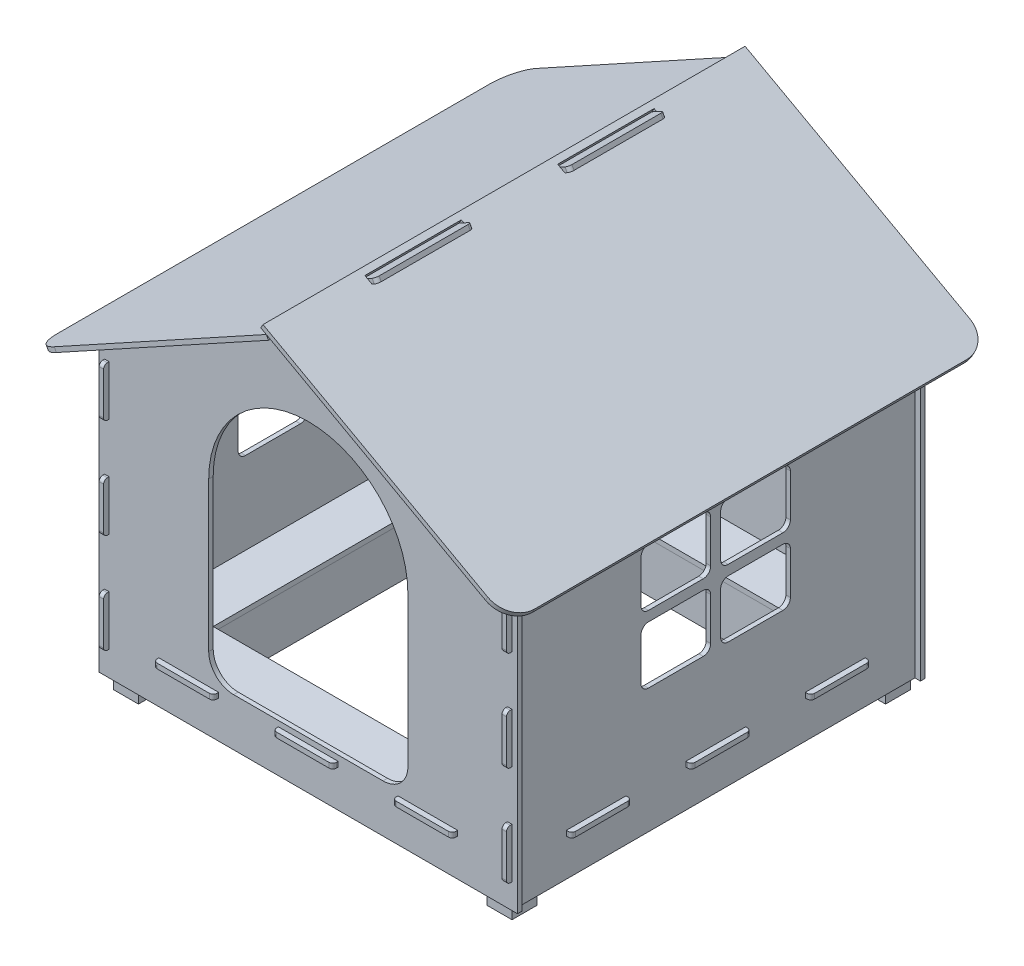
from build123d import *

# Parameters (mm, degrees)
STRUCTURAL_START               = -800
STRUCTURAL_MEMBER2_OUTLINE_W   = 1250
STRUCTURAL_MEMBER2_OUTLINE_H   = 100
STRUCTURAL_MEMBER2_DEPTH       = 100
STRUCTURAL_START_2             = 700
STRUCTURAL_MEMBER2_2_OUTLINE_W = 1250
STRUCTURAL_MEMBER2_2_OUTLINE_H = 100
STRUCTURAL_MEMBER2_2_DEPTH     = 100
STRUCTURAL_MEMBER4_DEPTH       = 2001.997512422
STRUCTURAL_MEMBER4_DEPTH_BACK  = 401.997512422
SKETCH18_W                     = 200
SKETCH18_H                     = 20
SKETCH18_ON_SEGMENT_2_W        = 200
SKETCH18_ON_SEGMENT_2_H        = 20
STRUCTURAL_MEMBER4_2_DEPTH     = 2403.995024845
SKETCH18_ON_SEGMENT_3_W        = 200
SKETCH18_ON_SEGMENT_3_H        = 20
STRUCTURAL_MEMBER4_3_DEPTH     = 2403.995024845
SKETCH18_ON_SEGMENT_4_W        = 200
SKETCH18_ON_SEGMENT_4_H        = 20
STRUCTURAL_MEMBER4_4_DEPTH     = 2403.995024845
STRUCTURAL_START_3             = -600
STRUCTURAL_MEMBER5_OUTLINE_W   = 20
STRUCTURAL_MEMBER5_OUTLINE_H   = 200
STRUCTURAL_MEMBER5_DEPTH       = 1200
STRUCTURAL_START_4             = -200
STRUCTURAL_MEMBER5_2_OUTLINE_W = 1240
STRUCTURAL_MEMBER5_2_OUTLINE_H = 20
STRUCTURAL_MEMBER5_2_DEPTH     = 200
STRUCTURAL_MEMBER5_3_OUTLINE_W = 1240
STRUCTURAL_MEMBER5_3_OUTLINE_H = 20
STRUCTURAL_MEMBER5_3_DEPTH     = 200
STRUCTURAL_MEMBER5_4_OUTLINE_W = 20
STRUCTURAL_MEMBER5_4_OUTLINE_H = 200
STRUCTURAL_MEMBER5_4_DEPTH     = 1200
MOVE_FACE2_BY                  = 40
MOVE_FACE2_2_BY                = 40
MOVE_FACE2_3_BY                = 40
MOVE_FACE2_4_BY                = 40
SKETCH110_W                    = 200
SKETCH110_H                    = 18
STRUCTURAL_MEMBER6_DEPTH       = 1936
MOVE_START                     = -1332.256013198
MOVE_FACE3_OUTLINE_W           = 930
MOVE_FACE3_OUTLINE_H           = 1936
MOVE_FACE3_DEPTH               = 18
FILLET5_R                      = 100
STRUCTURAL_START_5             = -150
STRUCTURAL_MEMBER7_OUTLINE_W   = 1600
STRUCTURAL_MEMBER7_OUTLINE_H   = 18
STRUCTURAL_MEMBER7_DEPTH       = 200
STRUCTURAL_MEMBER7_2_OUTLINE_W = 1600
STRUCTURAL_MEMBER7_2_OUTLINE_H = 18
STRUCTURAL_MEMBER7_2_DEPTH     = 200
STRUCTURAL_MEMBER7_3_OUTLINE_W = 18
STRUCTURAL_MEMBER7_3_OUTLINE_H = 1636
STRUCTURAL_MEMBER7_3_DEPTH     = 200
STRUCTURAL_MEMBER7_4_OUTLINE_W = 18
STRUCTURAL_MEMBER7_4_OUTLINE_H = 1636
STRUCTURAL_MEMBER7_4_DEPTH     = 200
MOVE_START_2                   = -818
MOVE_FACE4_OUTLINE_W           = 1000
MOVE_FACE4_OUTLINE_H           = 1636
MOVE_FACE4_DEPTH               = 18
MOVE_START_3                   = 800
MOVE_FACE4_2_OUTLINE_W         = 1000
MOVE_FACE4_2_OUTLINE_H         = 1636
MOVE_FACE4_2_DEPTH             = 18
MOVE_START_4                   = -800
MOVE_FACE5_OUTLINE_W           = 1450
MOVE_FACE5_OUTLINE_H           = 18
MOVE_FACE5_DEPTH               = 1600
MOVE_START_5                   = -840
MOVE_FACE6_OUTLINE_W           = 1650
MOVE_FACE6_OUTLINE_H           = 18
MOVE_FACE6_DEPTH               = 1680
MOVE_FACE7_BY                  = 22
MOVE_FACE7_2_BY                = 22
MOVE_FACE7_3_BY                = 22
MOVE_FACE7_4_BY                = 22
TRIM_EXTEND3_START             = -818
TRIM_EXTEND3_DEPTH             = 18
TRIM_EXTEND3_START_2           = 800
TRIM_EXTEND3_2_DEPTH           = 18
SKETCH113_W                    = 32.72
SKETCH113_H                    = 387.2
CUT_EXTRUDE2_DEPTH             = 18
SKETCH115_W                    = 32.72
SKETCH115_H                    = 387.2
SKETCH115_W_2                  = 25.080844949
CUT_EXTRUDE3_DEPTH             = 18
SKETCH117_W                    = 280
SKETCH117_H                    = 230
CUT_EXTRUDE4_DEPTH             = 2542.143663625
FILLET1_R                      = 30
FILLET2_R                      = 30
SKETCH119_W                    = 280
SKETCH119_H                    = 230
CUT_EXTRUDE7_DEPTH             = 18
FILLET4_R                      = 30
CUT_EXTRUDE8_DEPTH             = 18
SKETCH121_W                    = 40
SKETCH121_H                    = 200
SKETCH121_H_2                  = 100
CUT_EXTRUDE9_DEPTH             = 2542.143663625
SKETCH122_W                    = 18
SKETCH122_H                    = 200
CUT_EXTRUDE10_DEPTH            = 2545.327980132
SKETCH123_W                    = 100
SKETCH123_H                    = 20
SKETCH123_W_2                  = 240
CUT_EXTRUDE12_DEPTH            = 40
SKETCH124_W                    = 240
SKETCH124_H                    = 20
CUT_EXTRUDE13_DEPTH            = 1636
SKETCH125_W                    = 100
SKETCH125_H                    = 20
SKETCH125_W_2                  = 240
CUT_EXTRUDE14_DEPTH            = 40
SKETCH126_W                    = 240
SKETCH126_H                    = 20
CUT_EXTRUDE15_DEPTH            = 2545.327980132
FILLET6_R                      = 100
FILLET7_R                      = 15
FILLET8_R                      = 15
FILLET9_R                      = 15
CIRPATTERN5_COUNT              = 4


# Read off the part's stored shape, not the designer's step: Structural Member2, Structural Member5, Move Face3, Structural Member7, Move Face4, Move Face5, Move Face6, Trim/Extend3
with BuildPart() as part:
    # Structural Member2 outline → Structural Member2 (new body)
    with BuildSketch(Plane.YZ.offset(STRUCTURAL_START)):
        with Locations((425, -750)):
            Rectangle(STRUCTURAL_MEMBER2_OUTLINE_W, STRUCTURAL_MEMBER2_OUTLINE_H)
        with Locations((425, 750)):
            Rectangle(STRUCTURAL_MEMBER2_OUTLINE_W, STRUCTURAL_MEMBER2_OUTLINE_H)
    extrude(amount=STRUCTURAL_MEMBER2_DEPTH)


with BuildPart() as body_2:
    # Structural Member2 2 outline → Structural Member2 2 (new body)
    with BuildSketch(Plane.YZ.offset(STRUCTURAL_START_2)):
        with Locations((425, -750)):
            Rectangle(STRUCTURAL_MEMBER2_2_OUTLINE_W, STRUCTURAL_MEMBER2_2_OUTLINE_H)
        with Locations((425, 750)):
            Rectangle(STRUCTURAL_MEMBER2_2_OUTLINE_W, STRUCTURAL_MEMBER2_2_OUTLINE_H)
    extrude(amount=STRUCTURAL_MEMBER2_2_DEPTH)


with BuildPart() as body_3:
    # Sketch18 → Structural Member4 (new, two sides: drawn at the far end of the back side and taken through both)
    with BuildSketch(Plane(origin=(-600, 0, 800), x_dir=(-1, 0, 0), z_dir=(0, 0, -1)).offset(-STRUCTURAL_MEMBER4_DEPTH_BACK)):
        with Locations((100, 10)):
            Rectangle(SKETCH18_W, SKETCH18_H)
    extrude(amount=STRUCTURAL_MEMBER4_DEPTH + STRUCTURAL_MEMBER4_DEPTH_BACK)

    # Structural Member4 mitre 1
    split(bisect_by=Plane(origin=(-800, 0, 800), x_dir=(0, -1, 0), z_dir=(-0.707106781, 0, -0.707106781)), keep=Keep.TOP)

    # Structural Member4 mitre 2
    split(bisect_by=Plane(origin=(-800, 0, -800), x_dir=(0, -1, 0), z_dir=(-0.707106781, 0, 0.707106781)), keep=Keep.TOP)

    # Trim/Extend2
    split(bisect_by=Plane(origin=(750, 425, -700), x_dir=(0, -1, 0), z_dir=(0, 0, 1)), keep=Keep.TOP)

    # Trim_Extend2 40
    split(bisect_by=Plane(origin=(-750, 425, 700), x_dir=(0, 1, 0), z_dir=(0, 0, -1)), keep=Keep.TOP)

    # Move Face2: a face moved outward by 40.0
    extrude(body_3.faces().sort_by_distance((-800, 10, 0))[0], amount=MOVE_FACE2_BY, dir=(-1, 0, 0))


with BuildPart() as body_4:
    # Sketch18 on segment 2 (carried to segment 2) → Structural Member4 2 (new body)
    with BuildSketch(Plane(origin=(-1201.997512422, 0, -600), x_dir=(0, 0, -1), z_dir=(1, 0, 0))):
        with Locations((100, 10)):
            Rectangle(SKETCH18_ON_SEGMENT_2_W, SKETCH18_ON_SEGMENT_2_H)
    extrude(amount=STRUCTURAL_MEMBER4_2_DEPTH)

    # Structural Member4 2 mitre 1
    split(bisect_by=Plane(origin=(-800, 0, -800), x_dir=(0, 1, 0), z_dir=(0.707106781, 0, -0.707106781)), keep=Keep.TOP)

    # Structural Member4 2 mitre 2
    split(bisect_by=Plane(origin=(800, 0, -800), x_dir=(0, -1, 0), z_dir=(-0.707106781, 0, -0.707106781)), keep=Keep.TOP)

    # Trim_Extend2 13
    split(bisect_by=Plane(origin=(700, 425, 750), x_dir=(0, -1, 0), z_dir=(-1, 0, 0)), keep=Keep.TOP)

    # Trim_Extend2 44
    split(bisect_by=Plane(origin=(-700, 425, 750), x_dir=(0, 1, 0), z_dir=(1, 0, 0)), keep=Keep.TOP)

    # Move Face2 2: a face moved outward by 40.0
    extrude(body_4.faces().sort_by_distance((0, 10, -800))[0], amount=MOVE_FACE2_2_BY, dir=(0, 0, -1))

    # Sketch125 → Cut-Extrude14 (cut)
    with BuildSketch(Plane.XY.offset(-840)):
        with Locations((650, 10)):
            Rectangle(SKETCH125_W, SKETCH125_H)
        with Locations((240, 10)):
            Rectangle(SKETCH125_W_2, SKETCH125_H)
        with Locations((-240, 10)):
            Rectangle(SKETCH125_W_2, SKETCH125_H)
        with Locations((-650, 10)):
            Rectangle(SKETCH125_W, SKETCH125_H)
    cut_extrude14 = extrude(amount=CUT_EXTRUDE14_DEPTH, mode=Mode.SUBTRACT)


with BuildPart() as body_5:
    # Sketch18 on segment 3 (carried to segment 3) → Structural Member4 3 (new body)
    with BuildSketch(Plane(origin=(600, 0, -1201.997512422), x_dir=(1, 0, 0), z_dir=(0, 0, 1))):
        with Locations((100, 10)):
            Rectangle(SKETCH18_ON_SEGMENT_3_W, SKETCH18_ON_SEGMENT_3_H)
    extrude(amount=STRUCTURAL_MEMBER4_3_DEPTH)

    # Structural Member4 3 mitre 1
    split(bisect_by=Plane(origin=(800, 0, 800), x_dir=(0, 1, 0), z_dir=(0.707106781, 0, -0.707106781)), keep=Keep.TOP)

    # Structural Member4 3 mitre 2
    split(bisect_by=Plane(origin=(800, 0, -800), x_dir=(0, 1, 0), z_dir=(0.707106781, 0, 0.707106781)), keep=Keep.TOP)

    # Trim_Extend2 29: cut body 2
    add(body_2.part, mode=Mode.SUBTRACT)

    # Move Face2 3: a face moved outward by 40.0
    extrude(body_5.faces().sort_by_distance((800, 10, 0))[0], amount=MOVE_FACE2_3_BY, dir=(1, 0, 0))

    # Sketch123 → Cut-Extrude12 (cut)
    with BuildSketch(Plane(origin=(840, 0, 0), x_dir=(0, 0, -1), z_dir=(1, 0, 0))):
        with Locations((-650, 10)):
            Rectangle(SKETCH123_W, SKETCH123_H)
        with Locations((-240, 10)):
            Rectangle(SKETCH123_W_2, SKETCH123_H)
        with Locations((240, 10)):
            Rectangle(SKETCH123_W_2, SKETCH123_H)
        with Locations((650, 10)):
            Rectangle(SKETCH123_W, SKETCH123_H)
    cut_extrude12 = extrude(amount=-CUT_EXTRUDE12_DEPTH, mode=Mode.SUBTRACT)


with BuildPart() as body_6:
    # Sketch18 on segment 4 (carried to segment 4) → Structural Member4 4 (new body)
    with BuildSketch(Plane(origin=(1201.997512422, 0, 600), x_dir=(0, 0, 1), z_dir=(-1, 0, 0))):
        with Locations((100, 10)):
            Rectangle(SKETCH18_ON_SEGMENT_4_W, SKETCH18_ON_SEGMENT_4_H)
    extrude(amount=STRUCTURAL_MEMBER4_4_DEPTH)

    # Structural Member4 4 mitre 1
    split(bisect_by=Plane(origin=(-800, 0, 800), x_dir=(0, 1, 0), z_dir=(0.707106781, 0, 0.707106781)), keep=Keep.TOP)

    # Structural Member4 4 mitre 2
    split(bisect_by=Plane(origin=(800, 0, 800), x_dir=(0, -1, 0), z_dir=(-0.707106781, 0, 0.707106781)), keep=Keep.TOP)

    # Trim_Extend2 5
    split(bisect_by=Plane(origin=(700, 425, -750), x_dir=(0, -1, 0), z_dir=(-1, 0, 0)), keep=Keep.TOP)

    # Trim_Extend2 36
    split(bisect_by=Plane(origin=(-700, 425, -750), x_dir=(0, 1, 0), z_dir=(1, 0, 0)), keep=Keep.TOP)

    # Move Face2 4: a face moved outward by 40.0
    extrude(body_6.faces().sort_by_distance((0, 10, 800))[0], amount=MOVE_FACE2_4_BY, dir=(0, 0, 1))

    # Mirror4: Cut-Extrude14 across plane
    add(cut_extrude14.mirror(Plane.XY), mode=Mode.SUBTRACT)


with BuildPart() as body_7:
    # Structural Member5 outline → Structural Member5 (new body)
    with BuildSketch(Plane.XY.offset(STRUCTURAL_START_3)):
        with Locations((-610, -100)):
            Rectangle(STRUCTURAL_MEMBER5_OUTLINE_W, STRUCTURAL_MEMBER5_OUTLINE_H)
    extrude(amount=STRUCTURAL_MEMBER5_DEPTH)


with BuildPart() as body_8:
    # Structural Member5 2 outline → Structural Member5 2 (new body)
    with BuildSketch(Plane(origin=(0, 0, 0), x_dir=(1, 0, 0), z_dir=(0, 1, 0)).offset(STRUCTURAL_START_4)):
        with Locations((0, -610)):
            Rectangle(STRUCTURAL_MEMBER5_2_OUTLINE_W, STRUCTURAL_MEMBER5_2_OUTLINE_H)
    extrude(amount=STRUCTURAL_MEMBER5_2_DEPTH)


with BuildPart() as body_9:
    # Structural Member5 3 outline → Structural Member5 3 (new body)
    with BuildSketch(Plane(origin=(0, 0, 0), x_dir=(1, 0, 0), z_dir=(0, 1, 0)).offset(STRUCTURAL_START_4)):
        with Locations((0, 610)):
            Rectangle(STRUCTURAL_MEMBER5_3_OUTLINE_W, STRUCTURAL_MEMBER5_3_OUTLINE_H)
    extrude(amount=STRUCTURAL_MEMBER5_3_DEPTH)


with BuildPart() as body_10:
    # Structural Member5 4 outline → Structural Member5 4 (new body)
    with BuildSketch(Plane.XY.offset(STRUCTURAL_START_3)):
        with Locations((610, -100)):
            Rectangle(STRUCTURAL_MEMBER5_4_OUTLINE_W, STRUCTURAL_MEMBER5_4_OUTLINE_H)
    extrude(amount=STRUCTURAL_MEMBER5_4_DEPTH)


with BuildPart() as body_11:
    # Sketch110 → Structural Member6 (new body)
    with BuildSketch(Plane(origin=(-949.42560132, 977.699852575, -968), x_dir=(0.876170675465456, 0.4820009828355196, 0), z_dir=(0, 0, 1))):
        with Locations((100, 9)):
            Rectangle(SKETCH110_W, SKETCH110_H)
    extrude(amount=STRUCTURAL_MEMBER6_DEPTH)

    # Move Face3 outline → Move Face3 (add)
    with BuildSketch(Plane(origin=(0, 0, 0), x_dir=(0.8761706754654556, 0.4820009828355199, 0), z_dir=(0.4820009828355199, -0.8761706754654558, 0)).offset(MOVE_START)):
        with Locations((304.393419447, 0)):
            Rectangle(MOVE_FACE3_OUTLINE_W, MOVE_FACE3_OUTLINE_H)
    extrude(amount=MOVE_FACE3_DEPTH)

    # Fillet5
    fillet5_edges = [body_11.edges().sort_by_distance(p)[0] for p in [
        (-953.763610165, 985.585388654, 968),
        (-953.763610165, 985.585388654, -968),
    ]]
    fillet(fillet5_edges, radius=FILLET5_R)


with BuildPart() as body_12:
    # Mirror1: mirrored copy
    add(body_11.part.mirror(Plane(origin=(0, 0, 0), x_dir=(0, 0, 1), z_dir=(1, 0, 0))))

    # Sketch113 → Cut-Extrude2 (cut)
    with BuildSketch(Plane(origin=(642.14870775, 1167.283650977, 0), x_dir=(0.876170675465456, -0.4820009828355195, 0), z_dir=(0.48200098283551945, 0.8761706754654559, 0))):
        with Locations((-727.952574498, -387.2)):
            Rectangle(SKETCH113_W, SKETCH113_H)
        with Locations((-727.952574498, 387.2)):
            Rectangle(SKETCH113_W, SKETCH113_H)
    extrude(amount=-CUT_EXTRUDE2_DEPTH, mode=Mode.SUBTRACT)


with BuildPart() as body_13:
    # Structural Member7 outline → Structural Member7 (new body)
    with BuildSketch(Plane(origin=(0, 0, 0), x_dir=(1, 0, 0), z_dir=(0, 1, 0)).offset(STRUCTURAL_START_5)):
        with Locations((0, -809)):
            Rectangle(STRUCTURAL_MEMBER7_OUTLINE_W, STRUCTURAL_MEMBER7_OUTLINE_H)
    extrude(amount=STRUCTURAL_MEMBER7_DEPTH)



with BuildPart() as body_14:
    # Structural Member7 2 outline → Structural Member7 2 (new body)
    with BuildSketch(Plane(origin=(0, 0, 0), x_dir=(1, 0, 0), z_dir=(0, 1, 0)).offset(STRUCTURAL_START_5)):
        with Locations((0, 809)):
            Rectangle(STRUCTURAL_MEMBER7_2_OUTLINE_W, STRUCTURAL_MEMBER7_2_OUTLINE_H)
    extrude(amount=STRUCTURAL_MEMBER7_2_DEPTH)


with BuildPart() as body_15:
    # Structural Member7 3 outline → Structural Member7 3 (new body)
    with BuildSketch(Plane(origin=(0, 0, 0), x_dir=(1, 0, 0), z_dir=(0, 1, 0)).offset(STRUCTURAL_START_5)):
        with Locations((-809, 0)):
            Rectangle(STRUCTURAL_MEMBER7_3_OUTLINE_W, STRUCTURAL_MEMBER7_3_OUTLINE_H)
    extrude(amount=STRUCTURAL_MEMBER7_3_DEPTH)

    # Move Face4 outline → Move Face4 (add)
    with BuildSketch(Plane.YZ.offset(MOVE_START_2)):
        with Locations((550, 0)):
            Rectangle(MOVE_FACE4_OUTLINE_W, MOVE_FACE4_OUTLINE_H)
    extrude(amount=MOVE_FACE4_DEPTH)

    # Move Face7: a face moved outward by 22.0
    extrude(body_15.faces().sort_by_distance((-809, 450, 818))[0], amount=MOVE_FACE7_BY, dir=(0, 0, 1))

    # Move Face7 2: a face moved outward by 22.0
    extrude(body_15.faces().sort_by_distance((-809, 450, -818))[0], amount=MOVE_FACE7_2_BY, dir=(0, 0, -1))


with BuildPart() as body_16:
    # Structural Member7 4 outline → Structural Member7 4 (new body)
    with BuildSketch(Plane(origin=(0, 0, 0), x_dir=(1, 0, 0), z_dir=(0, 1, 0)).offset(STRUCTURAL_START_5)):
        with Locations((809, 0)):
            Rectangle(STRUCTURAL_MEMBER7_4_OUTLINE_W, STRUCTURAL_MEMBER7_4_OUTLINE_H)
    extrude(amount=STRUCTURAL_MEMBER7_4_DEPTH)

    # Move Face4 2 outline → Move Face4 2 (add)
    with BuildSketch(Plane.YZ.offset(MOVE_START_3)):
        with Locations((550, 0)):
            Rectangle(MOVE_FACE4_2_OUTLINE_W, MOVE_FACE4_2_OUTLINE_H)
    extrude(amount=MOVE_FACE4_2_DEPTH)

    # Move Face7 3: a face moved outward by 22.0
    extrude(body_16.faces().sort_by_distance((809, 450, 818))[0], amount=MOVE_FACE7_3_BY, dir=(0, 0, 1))

    # Move Face7 4: a face moved outward by 22.0
    extrude(body_16.faces().sort_by_distance((809, 450, -818))[0], amount=MOVE_FACE7_4_BY, dir=(0, 0, -1))


with BuildPart() as body_13_1:
    add(body_13.part)

    add(body_14.part)  # Move Face5 merges body 14
    # Move Face5 outline → Move Face5 (add)
    with BuildSketch(Plane.YZ.offset(MOVE_START_4)):
        with Locations((775, -809)):
            Rectangle(MOVE_FACE5_OUTLINE_W, MOVE_FACE5_OUTLINE_H)
        with Locations((775, 809)):
            Rectangle(MOVE_FACE5_OUTLINE_W, MOVE_FACE5_OUTLINE_H)
    extrude(amount=MOVE_FACE5_DEPTH)

    # Move Face6 outline → Move Face6 (add)
    with BuildSketch(Plane.YZ.offset(MOVE_START_5)):
        with Locations((675, 809)):
            Rectangle(MOVE_FACE6_OUTLINE_W, MOVE_FACE6_OUTLINE_H)
        with Locations((675, -809)):
            Rectangle(MOVE_FACE6_OUTLINE_W, MOVE_FACE6_OUTLINE_H)
    extrude(amount=MOVE_FACE6_DEPTH)

    # Trim/Extend3 outline → Trim/Extend3 (cut)
    with BuildSketch(Plane.XY.offset(TRIM_EXTEND3_START)):
        Polygon((-840, 1500), (-840, 1037.897310513), (0, 1500), align=None)
        Polygon((840, 1500), (0, 1500), (840, 1037.897310513), align=None)
    extrude(amount=TRIM_EXTEND3_DEPTH, mode=Mode.SUBTRACT)

    # Trim_Extend3 2 outline → Trim_Extend3 2 (cut)
    with BuildSketch(Plane.XY.offset(TRIM_EXTEND3_START_2)):
        Polygon((-840, 1500), (-840, 1037.897310513), (0, 1500), align=None)
        Polygon((840, 1500), (0, 1500), (840, 1037.897310513), align=None)
    extrude(amount=TRIM_EXTEND3_2_DEPTH, mode=Mode.SUBTRACT)

    # Sketch119 → Cut-Extrude7 (cut)
    with BuildSketch(Plane.XY.offset(-818)):
        with Locations((160, 735)):
            Rectangle(SKETCH119_W, SKETCH119_H)
        with Locations((160, 465)):
            Rectangle(SKETCH119_W, SKETCH119_H)
        with Locations((-160, 465)):
            Rectangle(SKETCH119_W, SKETCH119_H)
        with Locations((-160, 735)):
            Rectangle(SKETCH119_W, SKETCH119_H)
    extrude(amount=CUT_EXTRUDE7_DEPTH, mode=Mode.SUBTRACT)

    # Fillet4
    fillet4_edges = [body_13_1.edges().sort_by_distance(p)[0] for p in [
        (20, 850, -809),
        (20, 620, -809),
        (300, 620, -809),
        (300, 850, -809),
        (20, 580, -809),
        (20, 350, -809),
        (300, 350, -809),
        (300, 580, -809),
        (-20, 580, -809),
        (-300, 580, -809),
        (-300, 350, -809),
        (-20, 350, -809),
        (-300, 620, -809),
        (-20, 620, -809),
        (-20, 850, -809),
        (-300, 850, -809),
    ]]
    fillet(fillet4_edges, radius=FILLET4_R)

    # Sketch120 → Cut-Extrude8 (cut)
    with BuildSketch(Plane.XY.offset(818)):
        with BuildLine():
            Line((-400, 42), (400, 42))
            Line((400, 42), (400, 742))
            ThreePointArc((400, 742), (0, 1142), (-400, 742))
            Line((-400, 742), (-400, 42))
        make_face()
    extrude(amount=-CUT_EXTRUDE8_DEPTH, mode=Mode.SUBTRACT)

    # Sketch122 → Cut-Extrude10 (cut, through all)
    with BuildSketch(Plane.XY.offset(818)):
        with Locations((-809, 50)):
            Rectangle(SKETCH122_W, SKETCH122_H)
        with Locations((-809, 450)):
            Rectangle(SKETCH122_W, SKETCH122_H)
        with Locations((-809, 850)):
            Rectangle(SKETCH122_W, SKETCH122_H)
        with Locations((809, 850)):
            Rectangle(SKETCH122_W, SKETCH122_H)
        with Locations((809, 450)):
            Rectangle(SKETCH122_W, SKETCH122_H)
        with Locations((809, 50)):
            Rectangle(SKETCH122_W, SKETCH122_H)
    extrude(amount=-CUT_EXTRUDE10_DEPTH, mode=Mode.SUBTRACT)

    # Sketch126 → Cut-Extrude15 (cut, through all)
    with BuildSketch(Plane(origin=(0, 0, -818), x_dir=(-1, 0, 0), z_dir=(0, 0, -1))):
        with Locations((-480, 10)):
            Rectangle(SKETCH126_W, SKETCH126_H)
        with Locations((0, 10)):
            Rectangle(SKETCH126_W, SKETCH126_H)
        with Locations((480, 10)):
            Rectangle(SKETCH126_W, SKETCH126_H)
    extrude(amount=-CUT_EXTRUDE15_DEPTH, mode=Mode.SUBTRACT)

    # Fillet6
    fillet6_edges = [body_13_1.edges().sort_by_distance(p)[0] for p in [
        (-400, 42, 809),
        (400, 42, 809),
    ]]
    fillet(fillet6_edges, radius=FILLET6_R)


with BuildPart() as body_11_1:
    add(body_11.part)

    # Sketch115 → Cut-Extrude3 (cut)
    with BuildSketch(Plane(origin=(-642.14870775, 1167.283650977, 0), x_dir=(0.876170675465456, 0.4820009828355194, 0), z_dir=(-0.48200098283551934, 0.8761706754654559, 0))):
        with Locations((727.952574498, 774.4)):
            Rectangle(SKETCH115_W, SKETCH115_H)
        with Locations((727.952574498, 0)):
            Rectangle(SKETCH115_W, SKETCH115_H)
        with Locations((727.952574498, -774.4)):
            Rectangle(SKETCH115_W, SKETCH115_H)
        with Locations((756.852996973, -774.4)):
            Rectangle(SKETCH115_W_2, SKETCH115_H)
        with Locations((756.852996973, 0)):
            Rectangle(SKETCH115_W_2, SKETCH115_H)
        with Locations((756.852996973, 774.4)):
            Rectangle(SKETCH115_W_2, SKETCH115_H)
    extrude(amount=-CUT_EXTRUDE3_DEPTH, mode=Mode.SUBTRACT)

    # Fillet9
    fillet9_edges = [body_11_1.edges().sort_by_distance(p)[0] for p in [
        (36.309253111, 1530.246499258, 580.8),
        (36.309253111, 1530.246499258, -193.6),
        (36.309253111, 1530.246499258, 193.6),
        (36.309253111, 1530.246499258, -580.8),
    ]]
    fillet(fillet9_edges, radius=FILLET9_R)


with BuildPart() as cut_extrude4_tool:
    # Sketch117 → Cut-Extrude4 (new, through all)
    with BuildSketch(Plane(origin=(818, 0, 0), x_dir=(0, 0, -1), z_dir=(1, 0, 0))):
        with Locations((-160, 735)):
            Rectangle(SKETCH117_W, SKETCH117_H)
        with Locations((-160, 465)):
            Rectangle(SKETCH117_W, SKETCH117_H)
        with Locations((160, 465)):
            Rectangle(SKETCH117_W, SKETCH117_H)
        with Locations((160, 735)):
            Rectangle(SKETCH117_W, SKETCH117_H)
    extrude(amount=-CUT_EXTRUDE4_DEPTH)


with BuildPart() as body_15_1:
    add(body_15.part)

    # Cut-Extrude4: cut by cut_extrude4_tool
    add(cut_extrude4_tool.part, mode=Mode.SUBTRACT)

    # Fillet2
    fillet2_edges = [body_15_1.edges().sort_by_distance(p)[0] for p in [
        (-809, 620, 300),
        (-809, 850, 300),
        (-809, 850, 20),
        (-809, 620, 20),
        (-809, 580, 20),
        (-809, 350, 20),
        (-809, 350, 300),
        (-809, 580, 300),
        (-809, 580, -20),
        (-809, 580, -300),
        (-809, 350, -300),
        (-809, 350, -20),
        (-809, 850, -20),
        (-809, 850, -300),
        (-809, 620, -300),
        (-809, 620, -20),
    ]]
    fillet(fillet2_edges, radius=FILLET2_R)


with BuildPart() as body_16_1:
    add(body_16.part)

    # Cut-Extrude4: cut by cut_extrude4_tool
    add(cut_extrude4_tool.part, mode=Mode.SUBTRACT)

    # Fillet1
    fillet1_edges = [body_16_1.edges().sort_by_distance(p)[0] for p in [
        (809, 620, 300),
        (809, 850, 300),
        (809, 850, 20),
        (809, 620, 20),
        (809, 580, 20),
        (809, 350, 20),
        (809, 350, 300),
        (809, 580, 300),
        (809, 580, -20),
        (809, 580, -300),
        (809, 350, -300),
        (809, 350, -20),
        (809, 850, -20),
        (809, 850, -300),
        (809, 620, -300),
        (809, 620, -20),
    ]]
    fillet(fillet1_edges, radius=FILLET1_R)


with BuildPart() as cut_extrude9_tool:
    # Sketch121 → Cut-Extrude9 (new, through all)
    with BuildSketch(Plane(origin=(818, 0, 0), x_dir=(0, 0, -1), z_dir=(1, 0, 0))):
        with Locations((-820, 250)):
            Rectangle(SKETCH121_W, SKETCH121_H)
        with Locations((-820, 650)):
            Rectangle(SKETCH121_W, SKETCH121_H)
        with Locations((-820, 1000)):
            Rectangle(SKETCH121_W, SKETCH121_H_2)
        with Locations((-820, -100)):
            Rectangle(SKETCH121_W, SKETCH121_H_2)
    cut_extrude9 = extrude(amount=-CUT_EXTRUDE9_DEPTH)


with BuildPart() as body_15_2:
    add(body_15_1.part)

    # Cut-Extrude9: cut by cut_extrude9_tool
    add(cut_extrude9_tool.part, mode=Mode.SUBTRACT)


with BuildPart() as body_16_2:
    add(body_16_1.part)

    # Cut-Extrude9: cut by cut_extrude9_tool
    add(cut_extrude9_tool.part, mode=Mode.SUBTRACT)


with BuildPart() as mirror2_tool:
    # Mirror2: Cut-Extrude9 across plane
    add(cut_extrude9.mirror(Plane.XY))


with BuildPart() as body_15_3:
    add(body_15_2.part)

    # Mirror2: cut by mirror2_tool
    add(mirror2_tool.part, mode=Mode.SUBTRACT)


with BuildPart() as body_16_3:
    add(body_16_2.part)

    # Mirror2: cut by mirror2_tool
    add(mirror2_tool.part, mode=Mode.SUBTRACT)


with BuildPart() as cut_extrude13_tool:
    # Sketch124 → Cut-Extrude13 (new body)
    with BuildSketch(Plane(origin=(818, 0, 0), x_dir=(0, 0, -1), z_dir=(1, 0, 0))):
        with Locations((-480, 10)):
            Rectangle(SKETCH124_W, SKETCH124_H)
        with Locations((0, 10)):
            Rectangle(SKETCH124_W, SKETCH124_H)
        with Locations((480, 10)):
            Rectangle(SKETCH124_W, SKETCH124_H)
    extrude(amount=-CUT_EXTRUDE13_DEPTH)


with BuildPart() as body_15_4:
    add(body_15_3.part)

    # Cut-Extrude13: cut by cut_extrude13_tool
    add(cut_extrude13_tool.part, mode=Mode.SUBTRACT)

    # Fillet8
    fillet8_edges = [body_15_4.edges().sort_by_distance(p)[0] for p in [
        (-809, -50, 840),
        (-809, 550, 840),
        (-809, 750, 840),
        (-809, 150, 840),
        (-809, 350, 840),
        (-809, 950, 840),
        (-809, 350, -840),
        (-809, 150, -840),
        (-809, 950, -840),
        (-809, -50, -840),
        (-809, 750, -840),
        (-809, 550, -840),
    ]]
    fillet(fillet8_edges, radius=FILLET8_R)


with BuildPart() as body_16_4:
    add(body_16_3.part)

    # Cut-Extrude13: cut by cut_extrude13_tool
    add(cut_extrude13_tool.part, mode=Mode.SUBTRACT)


with BuildPart() as body_3_1:
    add(body_3.part)

    # Mirror3: Cut-Extrude12 across plane
    add(cut_extrude12.mirror(Plane(origin=(0, 0, 0), x_dir=(0, 0, 1), z_dir=(1, 0, 0))), mode=Mode.SUBTRACT)

    # Fillet7
    fillet7_edges = [body_3_1.edges().sort_by_distance(p)[0] for p in [
        (-840, 10, -600),
        (-840, 10, 600),
        (-840, 10, 120),
        (-840, 10, 360),
        (-840, 10, -360),
        (-840, 10, -120),
    ]]
    fillet(fillet7_edges, radius=FILLET7_R)


with BuildPart() as body_12_2:
    # Mirror5: mirrored copy
    add(body_15_4.part.mirror(Plane(origin=(0, 0, 0), x_dir=(0, 0, 1), z_dir=(1, 0, 0))))


with BuildPart() as cirpattern5_1:
    # CirPattern5: pattern copy
    add(body_3_1.part.rotate(Axis((0, 0, 0), (0, 1, 0)), 1 * 360 / CIRPATTERN5_COUNT))


with BuildPart() as cirpattern5_2:
    # CirPattern5: pattern copy
    add(body_3_1.part.rotate(Axis((0, 0, 0), (0, 1, 0)), 2 * 360 / CIRPATTERN5_COUNT))


with BuildPart() as cirpattern5_3:
    # CirPattern5: pattern copy
    add(body_3_1.part.rotate(Axis((0, 0, 0), (0, 1, 0)), 3 * 360 / CIRPATTERN5_COUNT))


solid = Compound([part.part, body_2.part, body_7.part, body_8.part, body_9.part, body_10.part, body_12.part, body_13_1.part, body_11_1.part, body_15_4.part, body_3_1.part, body_12_2.part, cirpattern5_1.part, cirpattern5_2.part, cirpattern5_3.part])
